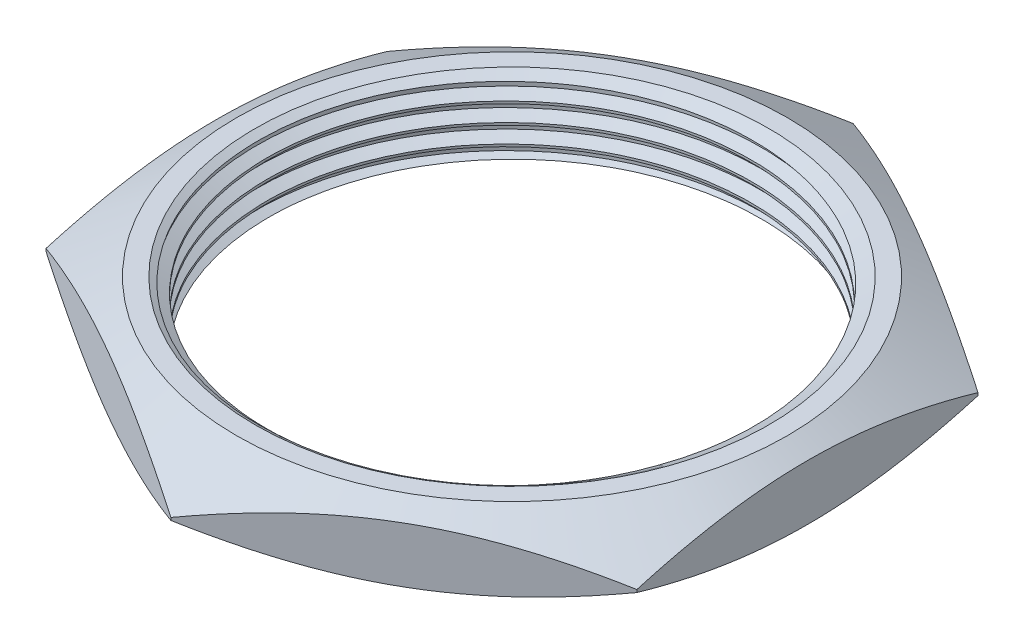
from build123d import *

# Parameters (mm, degrees)
SKETCH_1_R      = 9.1
EXTRUDE_1_DEPTH = 1.475
THREAD_1_PITCH  = 0.7


with BuildPart() as part:
    # Sketch 1 → Бобышка-Вытянуть1 (new, symmetric)
    with BuildSketch(Plane(origin=(0, 0, 0), x_dir=(1, 0, 0), z_dir=(0, 1, 0))):
        Polygon((11.1, 6.408587988), (0, 12.817175976), (-11.1, 6.408587988), (-11.1, -6.408587988), (0, -12.817175976), (11.1, -6.408587988), align=None)
        with Locations(Location((0, 0, 0), (0, 0, 270))):
            Circle(SKETCH_1_R, mode=Mode.SUBTRACT)
    extrude(amount=EXTRUDE_1_DEPTH, both=True)

    # Эскиз3 → Вырез-Повернуть1 (revolve, cut)
    with BuildSketch(Plane.ZY):
        Polygon((12.817175976, 0.05), (13.349003575, 0.05), (13.349003575, 3.05), (10.349003575, 3.05), (10.349003575, 1.475), align=None)
        Polygon((10.349003575, -1.475), (12.817175976, -0.05), (13.349003575, -0.05), (13.349003575, -3.05), (10.349003575, -3.05), align=None)
        Polygon((9.649003575, 2.075), (9.649003575, 1.475), (9.049003575, 1.128589838), (9.049003575, 2.075), align=None)
        Polygon((9.649003575, -2.075), (9.649003575, -1.475), (9.049003575, -1.128589838), (9.049003575, -2.075), align=None)
    revolve(axis=Axis((0, 8.08169474, 0), (0, -1, 0)), mode=Mode.SUBTRACT)

    # Резьба1: the profile of Sketch 1 2 profile screwed along a right-hand helix of 4.737236 turns, 6 arcs to a turn; built about Z, then put on its axis
    thread_1_z = Axis((0, 0, 0), (0, 0, 1))
    thread_1_corners = [(9.0997, 0, -0.000173205), (9.0997, 0, 0.612673203), (9.478886112, 0, 0.393749999), (9.478886112, 0, 0.218749999)]
    with BuildLine(mode=Mode.PRIVATE) as thread_1_profile:
        Line(thread_1_corners[0], thread_1_corners[1])
        Line(thread_1_corners[1], thread_1_corners[2])
        Line(thread_1_corners[2], thread_1_corners[3])
        Line(thread_1_corners[3], thread_1_corners[0])
    thread_1_cap = Face(thread_1_profile.wire())
    thread_1_turn_angles = [0, 30, 60, 90, 120, 150, 180, 210, 240, 270, 300, 330, 360]
    thread_1_turn_weights = [1, 0.8660254037844387, 1, 0.8660254037844387, 1, 0.8660254037844387, 1, 0.8660254037844387, 1, 0.8660254037844387, 1, 0.8660254037844387, 1]
    thread_1_turn_rails = [Edge.make_bspline([Vector(p[0], p[1], 0).rotate(thread_1_z, thread_1_turn_angles[k]) / thread_1_turn_weights[k] + Vector(0, 0, p[2] + THREAD_1_PITCH * thread_1_turn_angles[k] / 360) for k in range(13)], [0, 0, 0, 1, 1, 2, 2, 3, 3, 4, 4, 5, 5, 6, 6, 6], 2, thread_1_turn_weights) for p in thread_1_corners]
    thread_1_turn_sides = [Face.make_surface_from_curves(thread_1_turn_rails[p[0]], thread_1_turn_rails[p[1]]) for p in [(0, 1), (1, 2), (2, 3), (3, 0)]]
    thread_1_last_angles = [1440, 1470, 1500, 1530, 1560, 1590, 1620, 1650, 1680, 1692.702499573, 1705.404999146]
    thread_1_last_weights = [1, 0.8660254037844387, 1, 0.8660254037844387, 1, 0.8660254037844387, 1, 0.8660254037844387, 1, 0.9755249520562362, 1]
    thread_1_last_rails = [Edge.make_bspline([Vector(p[0], p[1], 0).rotate(thread_1_z, thread_1_last_angles[k]) / thread_1_last_weights[k] + Vector(0, 0, p[2] + THREAD_1_PITCH * thread_1_last_angles[k] / 360) for k in range(11)], [0, 0, 0, 1, 1, 2, 2, 3, 3, 4, 4, 5, 5, 5], 2, thread_1_last_weights) for p in thread_1_corners]
    thread_1_last_sides = [Face.make_surface_from_curves(thread_1_last_rails[p[0]], thread_1_last_rails[p[1]]) for p in [(0, 1), (1, 2), (2, 3), (3, 0)]]
    thread_1 = Plane(origin=(0, 2.158032638, 0), x_dir=(-1, 0, 0), z_dir=(0, -1, 0)) * Solid(Shell([*[p.moved(Location((0, 0, THREAD_1_PITCH * i))) for i in range(4) for p in thread_1_turn_sides], *thread_1_last_sides, thread_1_cap, thread_1_cap.rotate(thread_1_z, 1705.404999146).moved(Location((0, 0, THREAD_1_PITCH * 1705.404999146 / 360)))]))
    add(thread_1, mode=Mode.SUBTRACT)


solid = part.part
